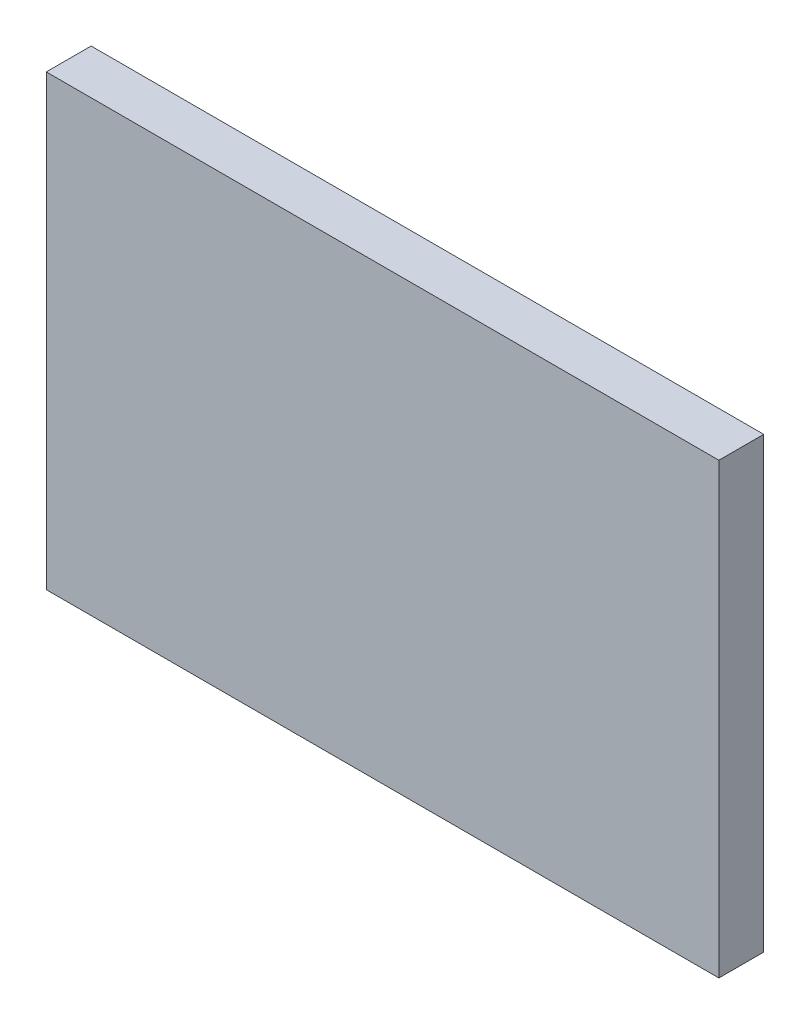
from build123d import *

# Parameters (mm, degrees)
SKETCH_1_W      = 60
SKETCH_1_H      = 40
EXTRUDE_1_DEPTH = 4


with BuildPart() as part:
    # Эскиз1 → Бобышка-Вытянуть1 (new body)
    with BuildSketch(Plane.XY):
        Rectangle(SKETCH_1_W, SKETCH_1_H)
    extrude(amount=EXTRUDE_1_DEPTH)


solid = part.part
